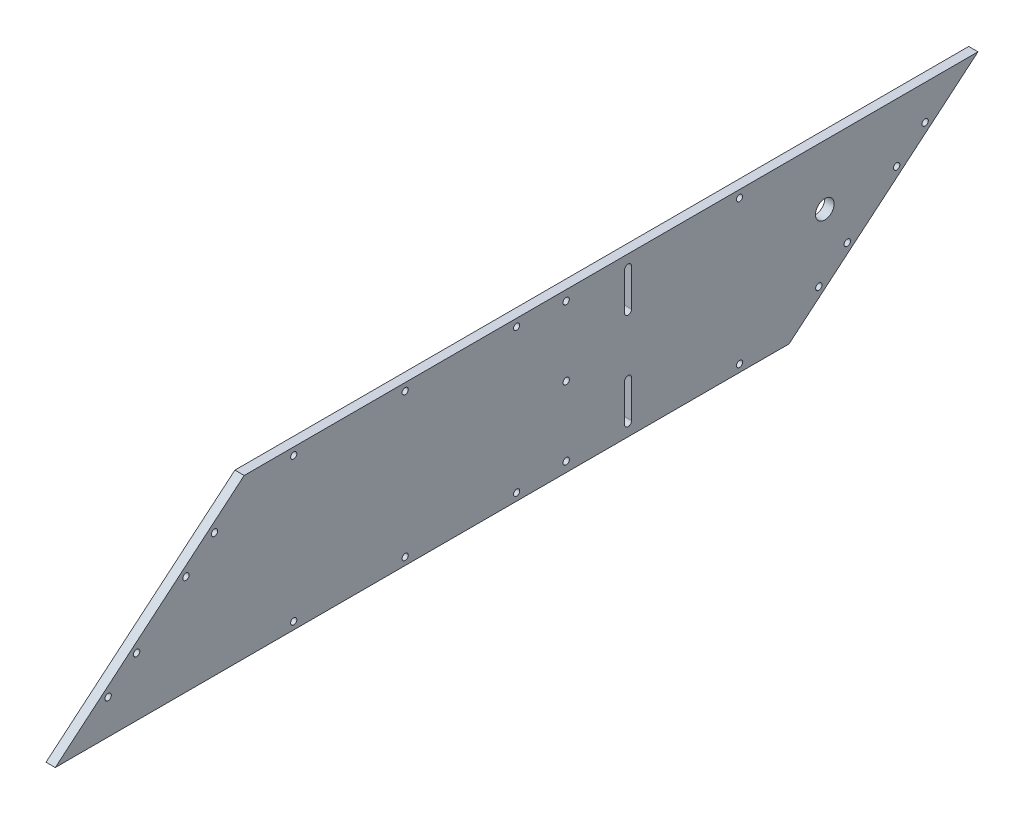
from build123d import *

# Parameters (mm, degrees)
BOSS_EXTRUDE1_DEPTH           = 4.7625
SKETCH2_R                     = 4.7625
GEARBOX_WITH_PRESS_FITS_DEPTH = 412.602247496
SKETCH3_R                     = 1.58115
CUT_EXTRUDE1_DEPTH            = 412.602247496
F_4_CLEARANCE_HOLE2_D         = 3.2639
F_4_CLEARANCE_HOLE2_DEPTH     = 28.702
F_4_CLEARANCE_HOLE2_TIP       = 0.980574487
F_4_CLEARANCE_HOLE1_D         = 3.2639
F_4_CLEARANCE_HOLE1_DEPTH     = 4.826
F_4_CLEARANCE_HOLE1_TIP       = 0.980574487


with BuildPart() as part:
    # Sketch1 → Boss-Extrude1 (new body)
    with BuildSketch(Plane(origin=(0, 0, 0), x_dir=(0, 0, -1), z_dir=(1, 0, 0))):
        Polygon((33.297595377, -40.64), (312.697595377, -40.64), (345.995190754, -12.7), (409.563327383, 40.64), (312.697595377, 40.64), (33.297595377, 40.64), (0, 12.7), (-63.568136629, -40.64), align=None)
    extrude(amount=BOSS_EXTRUDE1_DEPTH)

    # Sketch2 → Gearbox (with Press fits) (cut, through all)
    with BuildSketch(Plane(origin=(4.7625, 0, 0), x_dir=(0, 0, -1), z_dir=(1, 0, 0))):
        with Locations((331.004197306, 10)):
            Circle(SKETCH2_R)
    extrude(amount=-GEARBOX_WITH_PRESS_FITS_DEPTH, mode=Mode.SUBTRACT)

    # Sketch3 → Cut-Extrude1 (cut, through all)
    with BuildSketch(Plane(origin=(4.7625, 0, 0), x_dir=(0, 0, -1), z_dir=(1, 0, 0))):
        with Locations((287.297595377, 36.83)):
            Circle(SKETCH3_R)
        with Locations((172.997595377, 36.83)):
            Circle(SKETCH3_R)
        with Locations((115.847595377, 36.83)):
            Circle(SKETCH3_R)
        with Locations((58.697595377, 36.83)):
            Circle(SKETCH3_R)
        with Locations((58.697595377, -36.83)):
            Circle(SKETCH3_R)
        with Locations((115.847595377, -36.83)):
            Circle(SKETCH3_R)
        with Locations((172.997595377, -36.83)):
            Circle(SKETCH3_R)
        with Locations((287.297595377, -36.83)):
            Circle(SKETCH3_R)
        with BuildLine():
            Line((231.976395377, 34.29), (231.976395377, 15.24))
            ThreePointArc((231.976395377, 15.24), (230.147595377, 13.4112), (228.318795377, 15.24))
            Line((228.318795377, 15.24), (228.318795377, 34.29))
            ThreePointArc((228.318795377, 34.29), (230.147595377, 36.1188), (231.976395377, 34.29))
        make_face()
        with BuildLine():
            Line((231.976395377, -34.29), (231.976395377, -15.24))
            ThreePointArc((231.976395377, -15.24), (230.147595377, -13.4112), (228.318795377, -15.24))
            Line((228.318795377, -15.24), (228.318795377, -34.29))
            ThreePointArc((228.318795377, -34.29), (230.147595377, -36.1188), (231.976395377, -34.29))
        make_face()
    extrude(amount=-CUT_EXTRUDE1_DEPTH, mode=Mode.SUBTRACT)

    # #4 Clearance Hole2
    with Locations(Plane(origin=(4.7625, 0, 0), x_dir=(0, 0, -1), z_dir=(1, 0, 0))):
        with Locations((327.962613202, -22.8575274), (342.555759844, -10.612423436), (367.850547356, 10.612423436), (382.443693997, 22.8575274), (18.032577552, 22.8575274), (3.43943091, 10.612423436), (-21.855356602, -10.612423436), (-36.448503243, -22.8575274)):
            Hole(F_4_CLEARANCE_HOLE2_D / 2, depth=F_4_CLEARANCE_HOLE2_DEPTH)
            with Locations((0, 0, -(F_4_CLEARANCE_HOLE2_DEPTH + F_4_CLEARANCE_HOLE2_TIP / 2))):  # 118° drill point
                Cone(0, F_4_CLEARANCE_HOLE2_D / 2, F_4_CLEARANCE_HOLE2_TIP, mode=Mode.SUBTRACT)

    # #4 Clearance Hole1
    with Locations(Plane(origin=(4.7625, 0, 0), x_dir=(0, 0, -1), z_dir=(1, 0, 0))):
        with Locations((198.397595377, 35.56), (198.397595377, -35.56), (198.397595377, 0)):
            Hole(F_4_CLEARANCE_HOLE1_D / 2, depth=F_4_CLEARANCE_HOLE1_DEPTH)
            with Locations((0, 0, -(F_4_CLEARANCE_HOLE1_DEPTH + F_4_CLEARANCE_HOLE1_TIP / 2))):  # 118° drill point
                Cone(0, F_4_CLEARANCE_HOLE1_D / 2, F_4_CLEARANCE_HOLE1_TIP, mode=Mode.SUBTRACT)


solid = part.part
